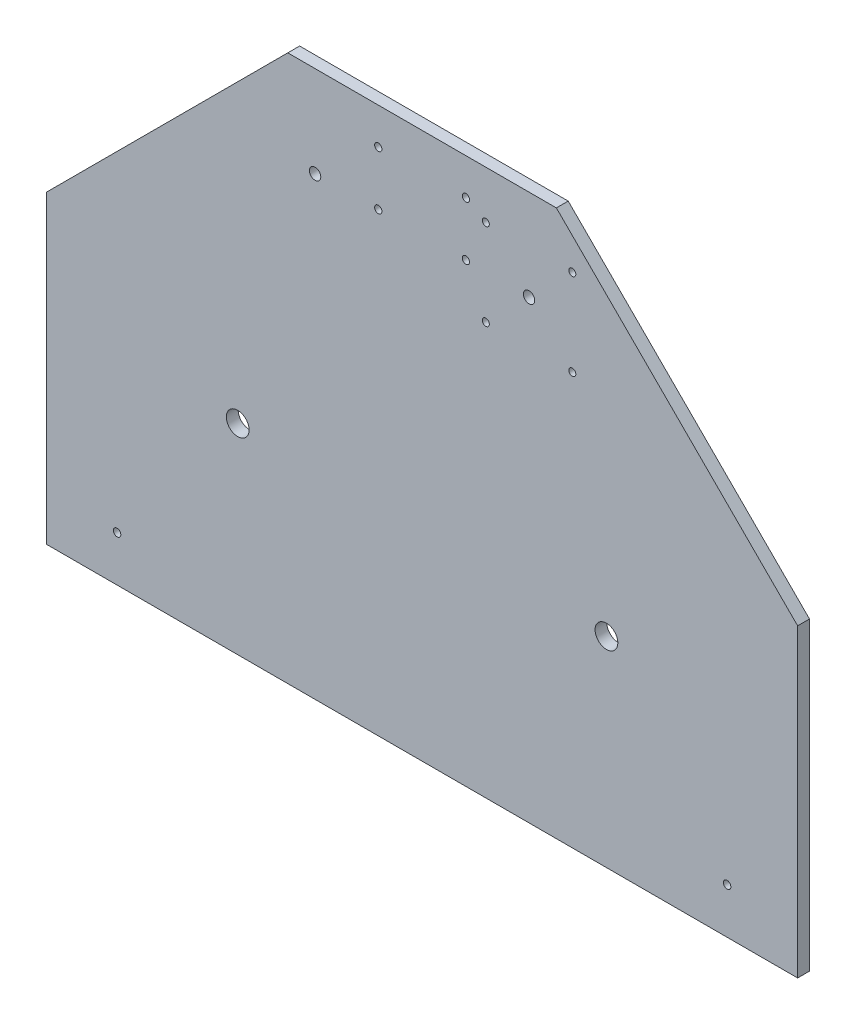
from build123d import *

# Parameters (mm, degrees)
REFERENCE_R         = 6.35
REFERENCE_R_2       = 3.175
REFERENCE_R_3       = 2.0955
REFERENCE_R_4       = 1.9685
REFERENCE_R_5       = 2.032
BOSS_EXTRUDE3_DEPTH = 6.604


with BuildPart() as part:
    # reference → Boss-Extrude3 (new body)
    with BuildSketch(Plane.XY):
        Polygon((209.55, 0), (-209.55, 0), (-209.55, 170.18), (-74.93, 304.8), (74.93, 304.8), (209.55, 170.18), align=None)
        with Locations((-102.87, 111.76)):
            Circle(REFERENCE_R, mode=Mode.SUBTRACT)
        with Locations((102.87, 111.76)):
            Circle(REFERENCE_R, mode=Mode.SUBTRACT)
        with Locations((-59.69, 254)):
            Circle(REFERENCE_R_2, mode=Mode.SUBTRACT)
        with Locations((59.69, 254)):
            Circle(REFERENCE_R_2, mode=Mode.SUBTRACT)
        with Locations((170.18, 25.4)):
            Circle(REFERENCE_R_3, mode=Mode.SUBTRACT)
        with Locations((-170.18, 25.4)):
            Circle(REFERENCE_R_3, mode=Mode.SUBTRACT)
        with Locations((83.82, 229.87)):
            Circle(REFERENCE_R_4, mode=Mode.SUBTRACT)
        with Locations((35.56, 229.87)):
            Circle(REFERENCE_R_4, mode=Mode.SUBTRACT)
        with Locations((83.82, 278.13)):
            Circle(REFERENCE_R_4, mode=Mode.SUBTRACT)
        with Locations((35.56, 278.13)):
            Circle(REFERENCE_R_4, mode=Mode.SUBTRACT)
        with Locations((24.4475, 284.48)):
            Circle(REFERENCE_R_5, mode=Mode.SUBTRACT)
        with Locations((24.4475, 254.381)):
            Circle(REFERENCE_R_5, mode=Mode.SUBTRACT)
        with Locations((-24.4475, 254.381)):
            Circle(REFERENCE_R_5, mode=Mode.SUBTRACT)
        with Locations((-24.4475, 284.48)):
            Circle(REFERENCE_R_5, mode=Mode.SUBTRACT)
    extrude(amount=BOSS_EXTRUDE3_DEPTH)


solid = part.part
